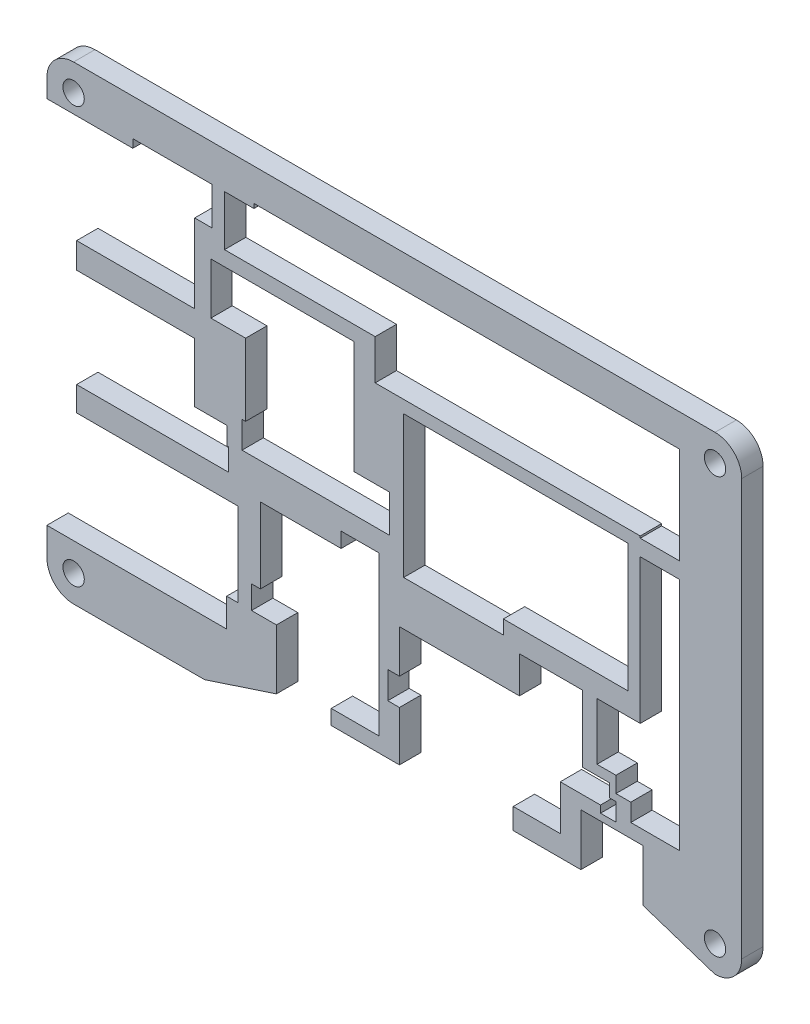
from build123d import *

# Parameters (mm, degrees)
BOSS_EXTRUDE1_OUTLINE_R = 1.3462
BOSS_EXTRUDE1_DEPTH     = 3.048
SKETCH14_W              = 2.2754
SKETCH14_H              = 2.1513
CUT_EXTRUDE2_DEPTH      = 430.898988368
SKETCH15_W              = 16.8402
SKETCH15_H              = 14.1197
SKETCH15_H_2            = 15.4101
CUT_EXTRUDE3_DEPTH      = 430.898988368
SKETCH16_R              = 1.524
CUT_EXTRUDE4_DEPTH      = 430.898988368
SKETCH17_W              = 13.7159
SKETCH17_H              = 5.7149
SKETCH17_W_2            = 4.1917
SKETCH17_H_2            = 7.175
CUT_EXTRUDE5_DEPTH      = 430.898988368
SKETCH18_W              = 1.778
SKETCH18_H              = 5.3847
BOSS_EXTRUDE9_DEPTH     = 3.048


# Read off the part's stored shape, not the designer's step: Boss-Extrude1
with BuildPart() as part:
    # Boss-Extrude1 outline → Boss-Extrude1 (new body)
    with BuildSketch(Plane.XY):
        with BuildLine():
            ThreePointArc((-397.247125, 154.7804), (-399.946077222, 153.659592612), (-401.0571, 150.956597849))
            Line((-401.0571, 150.956597849), (-401.0571, 148.341))
            Line((-401.0571, 148.341), (-388.8032, 148.341))
            Line((-388.8032, 148.341), (-388.8032, 149.5347))
            Line((-388.8032, 149.5347), (-375.7222, 149.5347))
            Line((-375.7222, 149.5347), (-375.7222, 144.15))
            Line((-375.7222, 144.15), (-380.1672, 144.15))
            Line((-380.1672, 144.15), (-380.1672, 132.9309))
            Line((-380.1672, 132.9309), (-396.8172, 132.9309))
            Line((-396.8172, 132.9309), (-396.8172, 129.2706))
            Line((-396.8172, 129.2706), (-380.1672, 129.2706))
            Line((-380.1672, 129.2706), (-380.1672, 120.8224))
            Line((-380.1672, 120.8224), (-375.3812, 120.8224))
            Line((-375.3812, 120.8224), (-375.3812, 118.2824))
            Line((-375.3812, 118.2824), (-375.1272, 118.2824))
            Line((-375.1272, 118.2824), (-375.1272, 115.1509))
            Line((-375.1272, 115.1509), (-396.8172, 115.1509))
            Line((-396.8172, 115.1509), (-396.8172, 111.6447))
            Line((-396.8172, 111.6447), (-373.7775, 111.6447))
            Line((-373.7775, 111.6447), (-373.7775, 99.7089))
            Line((-373.7775, 99.7089), (-375.4172, 99.7089))
            Line((-375.4172, 99.7089), (-375.4172, 95.6449))
            Line((-375.4172, 95.6449), (-401.0571, 95.6449))
            Line((-401.0571, 95.6449), (-401.0571, 91.659304166))
            ThreePointArc((-401.0571, 91.659304166), (-399.951018769, 88.947400452), (-397.2472, 87.8217))
            Line((-397.2472, 87.8217), (-378.5565, 87.8217))
            Line((-378.5565, 87.8217), (-368.3165, 91.1883))
            Line((-368.3165, 91.1883), (-368.3165, 99.7089))
            Line((-368.3165, 99.7089), (-371.8725, 99.7089))
            Line((-371.8725, 99.7089), (-371.8725, 103.0109))
            Line((-371.8725, 103.0109), (-370.6025, 103.0109))
            Line((-370.6025, 103.0109), (-370.6025, 113.7612))
            Line((-370.6025, 113.7612), (-356.8152, 113.7612))
            Line((-356.8152, 113.7612), (-356.8152, 115.9125))
            Line((-356.8152, 115.9125), (-353.6872, 115.9125))
            Line((-353.6872, 115.9125), (-353.6872, 93.3059))
            Line((-353.6872, 93.3059), (-360.5003, 93.3059))
            Line((-360.5003, 93.3059), (-360.5003, 91.1883))
            Line((-360.5003, 91.1883), (-350.7686, 91.1883))
            Line((-350.7686, 91.1883), (-350.7686, 98.2843))
            Line((-350.7686, 98.2843), (-352.4372, 98.2843))
            Line((-352.4372, 98.2843), (-352.4372, 102.1451))
            Line((-352.4372, 102.1451), (-350.7686, 102.1451))
            Line((-350.7686, 102.1451), (-350.7686, 108.2665))
            Line((-350.7686, 108.2665), (-333.6613, 108.2665))
            Line((-333.6613, 108.2665), (-333.6613, 113.4801))
            Line((-333.6613, 113.4801), (-324.6295, 113.4801))
            Line((-324.6295, 113.4801), (-324.6295, 103.9551))
            Line((-324.6295, 103.9551), (-320.8233, 103.9551))
            Line((-320.8233, 103.9551), (-320.8233, 102.0978))
            Line((-320.8233, 102.0978), (-319.8913, 102.0978))
            Line((-319.8913, 102.0978), (-319.8913, 99.5578))
            Line((-319.8913, 99.5578), (-322.0933, 99.5578))
            Line((-322.0933, 99.5578), (-322.0933, 100.5738))
            Line((-322.0933, 100.5738), (-327.8337, 100.5738))
            Line((-327.8337, 100.5738), (-327.8337, 94.1717))
            Line((-327.8337, 94.1717), (-334.5393, 94.1717))
            Line((-334.5393, 94.1717), (-334.5393, 91.1883))
            Line((-334.5393, 91.1883), (-324.8873, 91.1883))
            Line((-324.8873, 91.1883), (-324.8873, 98.5911))
            Line((-324.8873, 98.5911), (-315.9973, 98.5911))
            Line((-315.9973, 98.5911), (-315.9973, 91.1883))
            Line((-315.9973, 91.1883), (-305.7573, 87.8217))
            ThreePointArc((-305.7573, 87.8217), (-303.063223164, 88.937623164), (-301.9473, 91.6317))
            Line((-301.9473, 91.6317), (-301.9473, 150.9704))
            ThreePointArc((-301.9473, 150.9704), (-303.063223164, 153.664476836), (-305.7573, 154.7804))
            Line((-305.7573, 154.7804), (-397.247125, 154.7804))
        make_face()
        with Locations((-397.2472, 91.6317)):
            Circle(BOSS_EXTRUDE1_OUTLINE_R, mode=Mode.SUBTRACT)
        with Locations((-305.7573, 91.6317)):
            Circle(BOSS_EXTRUDE1_OUTLINE_R, mode=Mode.SUBTRACT)
        Polygon((-322.5975, 105.3521), (-322.5975, 113.4801), (-316.4253, 113.4801), (-316.4253, 134.0739), (-310.8373, 134.0739), (-310.8373, 100.5738), (-317.7753, 100.5738), (-317.7753, 103.0869), (-319.8913, 103.0869), (-319.8913, 105.3521), align=None, mode=Mode.SUBTRACT)
        Polygon((-372.7142, 122.6512), (-372.7142, 132.9309), (-377.6672, 132.9309), (-377.6672, 140.2451), (-357.2832, 140.2451), (-357.2832, 124.1751), (-352.2032, 124.1751), (-352.2032, 118.8412), (-373.2222, 118.8412), (-373.2222, 122.6512), align=None, mode=Mode.SUBTRACT)
        with Locations((-397.247125, 150.9704)):
            Circle(BOSS_EXTRUDE1_OUTLINE_R, mode=Mode.SUBTRACT)
        Polygon((-335.9473, 116.6297), (-335.9473, 114.6425), (-350.1712, 114.6425), (-350.1712, 134.8668), (-318.2033, 134.8668), (-318.2033, 116.6297), align=None, mode=Mode.SUBTRACT)
        Polygon((-310.8374, 136.3599), (-316.4253, 136.3599), (-316.4253, 136.6448), (-340.5193, 136.6448), (-340.5193, 142.3597), (-371.5305, 142.3597), (-371.5305, 150.1697), (-310.8373, 150.1697), align=None, mode=Mode.SUBTRACT)
        with Locations((-305.7573, 150.9704)):
            Circle(BOSS_EXTRUDE1_OUTLINE_R, mode=Mode.SUBTRACT)
    extrude(amount=BOSS_EXTRUDE1_DEPTH)

    # Sketch14 → Cut-Extrude2 (cut, through all)
    with BuildSketch(Plane(origin=(0, 0, 0), x_dir=(-1, 0, 0), z_dir=(0, 0, -1))):
        with Locations((357.9529, 114.83685)):
            Rectangle(SKETCH14_W, SKETCH14_H)
    extrude(amount=-CUT_EXTRUDE2_DEPTH, mode=Mode.SUBTRACT)

    # Sketch15 → Cut-Extrude3 (cut, through all)
    with BuildSketch(Plane(origin=(0, 0, 0), x_dir=(-1, 0, 0), z_dir=(0, 0, -1))):
        with Locations((388.3971, 122.21075)):
            Rectangle(SKETCH15_W, SKETCH15_H)
        with Locations((388.3971, 140.63595)):
            Rectangle(SKETCH15_W, SKETCH15_H_2)
    extrude(amount=-CUT_EXTRUDE3_DEPTH, mode=Mode.SUBTRACT)

    # Sketch16 → Cut-Extrude4 (cut, through all)
    with BuildSketch(Plane.XY.offset(3.048)):
        with Locations((-397.247125, 150.9704)):
            Circle(SKETCH16_R)
        with Locations((-305.7573, 150.9704)):
            Circle(SKETCH16_R)
        with Locations((-305.7573, 91.6317)):
            Circle(SKETCH16_R)
        with Locations((-397.2472, 91.6317)):
            Circle(SKETCH16_R)
    extrude(amount=-CUT_EXTRUDE4_DEPTH, mode=Mode.SUBTRACT)

    # Sketch17 → Cut-Extrude5 (cut, through all)
    with BuildSketch(Plane(origin=(0, 0, 0), x_dir=(-1, 0, 0), z_dir=(0, 0, -1))):
        with Locations((347.37725, 139.50225)):
            Rectangle(SKETCH17_W, SKETCH17_H)
        with Locations((373.62635, 145.9472)):
            Rectangle(SKETCH17_W_2, SKETCH17_H_2)
    extrude(amount=-CUT_EXTRUDE5_DEPTH, mode=Mode.SUBTRACT)

    # Sketch18 → Boss-Extrude9 (add)
    with BuildSketch(Plane(origin=(0, 0, 0), x_dir=(-1, 0, 0), z_dir=(0, 0, -1))):
        with Locations((376.6112, 146.84235)):
            Rectangle(SKETCH18_W, SKETCH18_H)
    extrude(amount=-BOSS_EXTRUDE9_DEPTH)


solid = part.part
